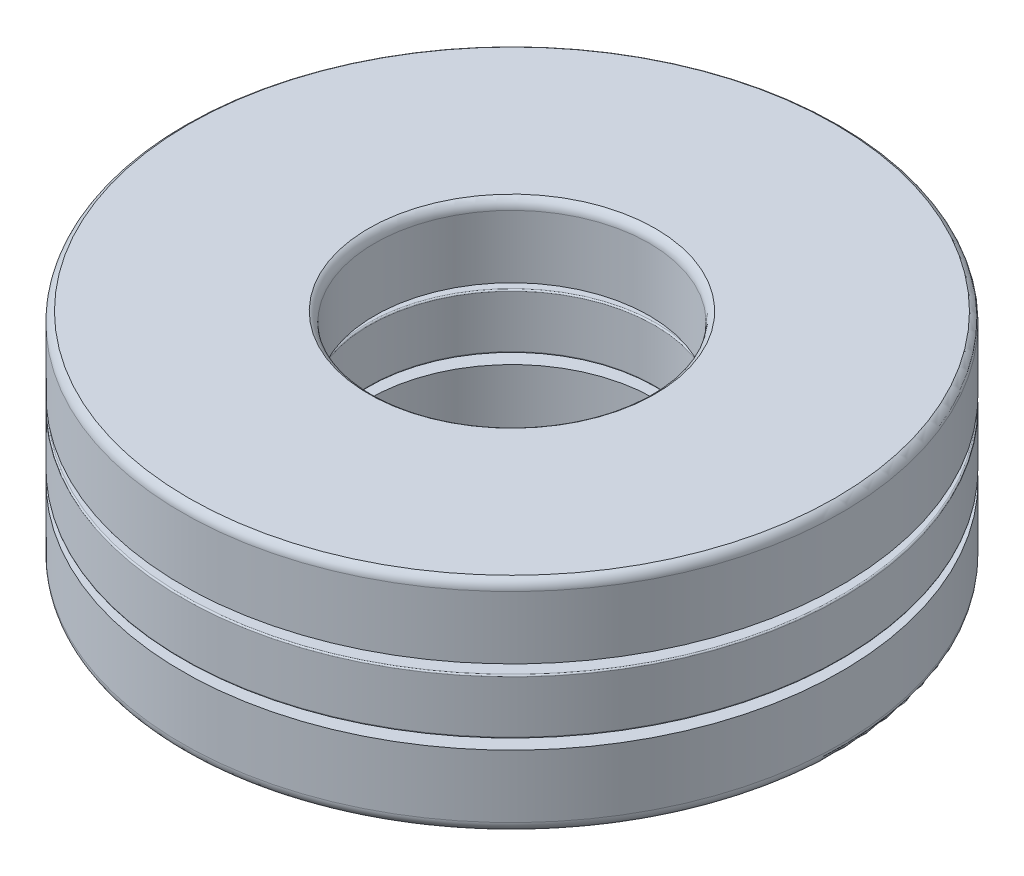
from build123d import *

# Parameters (mm, degrees)
CIRPATTERN1_COUNT = 8
CIRPATTERN2_COUNT = 8


# Read off the part's stored shape, not the designer's step: Cut-Revolve1
with BuildPart() as part:
    # Sketch3 → Revolve1 (revolve)
    with BuildSketch(Plane(origin=(0, 0, 0), x_dir=(0, 0, -1), z_dir=(1, 0, 0))):
        with BuildLine():
            Line((6, 0.68), (5.378529091, 0.68))
            ThreePointArc((5.378529091, 0.68), (4.3, 1.275), (3.221470909, 0.68))
            Line((3.221470909, 0.68), (2.5, 0.68))
            Line((2.5, 0.68), (2.5, 1.821394289))
            ThreePointArc((2.5, 1.821394289), (2.529706136, 1.926275174), (2.61, 2))
            Line((2.61, 2), (5.89, 2))
            ThreePointArc((5.89, 2), (5.970293864, 1.926275174), (6, 1.821394289))
            Line((6, 1.821394289), (6, 0.68))
        make_face()
        with BuildLine():
            Line((3.221470909, -0.68), (2.6, -0.68))
            Line((2.6, -0.68), (2.6, -1.821394289))
            ThreePointArc((2.6, -1.821394289), (2.629706136, -1.926275174), (2.71, -2))
            Line((2.71, -2), (5.89, -2))
            ThreePointArc((5.89, -2), (5.970293864, -1.926275174), (6, -1.821394289))
            Line((6, -1.821394289), (6, -0.68))
            Line((6, -0.68), (5.378529091, -0.68))
            ThreePointArc((5.378529091, -0.68), (4.3, -1.275), (3.221470909, -0.68))
        make_face()
        with BuildLine():
            Line((5.975, 0.5), (2.625, 0.5))
            ThreePointArc((2.625, 0.5), (2.60732233, 0.49267767), (2.6, 0.475))
            Line((2.6, 0.475), (2.6, -0.475))
            ThreePointArc((2.6, -0.475), (2.60732233, -0.49267767), (2.625, -0.5))
            Line((2.625, -0.5), (5.975, -0.5))
            ThreePointArc((5.975, -0.5), (5.99267767, -0.49267767), (6, -0.475))
            Line((6, -0.475), (6, 0.475))
            ThreePointArc((6, 0.475), (5.99267767, 0.49267767), (5.975, 0.5))
        make_face()
    revolve(axis=Axis((0, -2, 0), (0, 1, 0)))

    # Cut-Revolve1 outline → Cut-Revolve1 (revolve, cut)
    with BuildSketch(Plane.XY.offset(-4.3)):
        with BuildLine():
            Line((1.241874213, 0.500000001), (0, 0.500000001))
            Line((0, 0.500000001), (0, -0.500000001))
            Line((0, -0.500000001), (1.241874213, -0.500000001))
            ThreePointArc((1.241874213, -0.500000001), (1.33875, 0), (1.241874213, 0.500000001))
        make_face()
    cut_revolve1 = revolve(axis=Axis((0, 0, -4.3), (0, 1, 0)), mode=Mode.SUBTRACT)

    # CirPattern2: Cut-Revolve1 ×8 about axis
    cirpattern2_axis = Axis((0, 0, 0), (0, 1, 0))
    for i in range(1, CIRPATTERN2_COUNT):
        add(cut_revolve1.rotate(cirpattern2_axis, i * 360 / CIRPATTERN2_COUNT), mode=Mode.SUBTRACT)


with BuildPart() as body_2:
    # Sketch4 → Revolve2 (revolve)
    with BuildSketch(Plane(origin=(0, 0, 0), x_dir=(0, 0, -1), z_dir=(1, 0, 0))):
        with BuildLine():
            Line((4.3, -1.275), (4.3, 1.275))
            ThreePointArc((4.3, 1.275), (3.025, 0), (4.3, -1.275))
        make_face()
    revolve(axis=Axis((0, 2, -4.3), (0, -1, 0)))


with BuildPart() as cirpattern1_1:
    # CirPattern1: pattern copy
    add(body_2.part.rotate(Axis((0, 0, 0), (0, 1, 0)), 1 * 360 / CIRPATTERN1_COUNT))


with BuildPart() as cirpattern1_2:
    # CirPattern1: pattern copy
    add(body_2.part.rotate(Axis((0, 0, 0), (0, 1, 0)), 2 * 360 / CIRPATTERN1_COUNT))


with BuildPart() as cirpattern1_3:
    # CirPattern1: pattern copy
    add(body_2.part.rotate(Axis((0, 0, 0), (0, 1, 0)), 3 * 360 / CIRPATTERN1_COUNT))


with BuildPart() as cirpattern1_4:
    # CirPattern1: pattern copy
    add(body_2.part.rotate(Axis((0, 0, 0), (0, 1, 0)), 4 * 360 / CIRPATTERN1_COUNT))


with BuildPart() as cirpattern1_5:
    # CirPattern1: pattern copy
    add(body_2.part.rotate(Axis((0, 0, 0), (0, 1, 0)), 5 * 360 / CIRPATTERN1_COUNT))


with BuildPart() as cirpattern1_6:
    # CirPattern1: pattern copy
    add(body_2.part.rotate(Axis((0, 0, 0), (0, 1, 0)), 6 * 360 / CIRPATTERN1_COUNT))


with BuildPart() as cirpattern1_7:
    # CirPattern1: pattern copy
    add(body_2.part.rotate(Axis((0, 0, 0), (0, 1, 0)), 7 * 360 / CIRPATTERN1_COUNT))


solid = Compound([part.part, body_2.part, cirpattern1_1.part, cirpattern1_2.part, cirpattern1_3.part, cirpattern1_4.part, cirpattern1_5.part, cirpattern1_6.part, cirpattern1_7.part])
